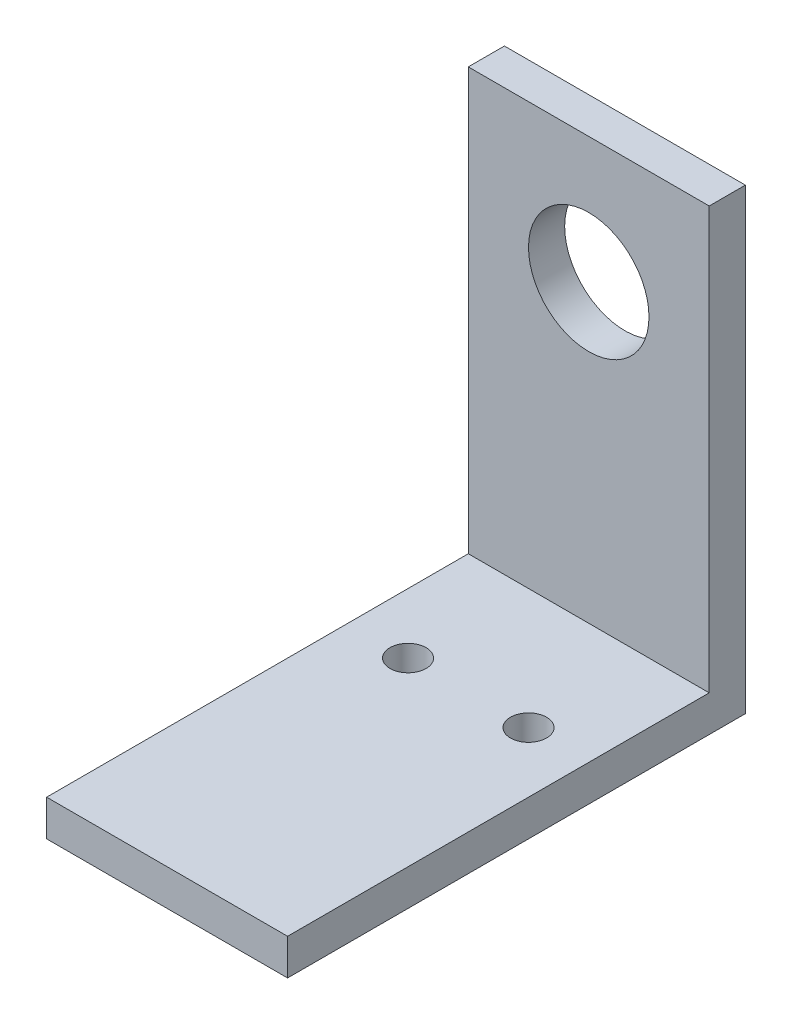
from build123d import *

# Parameters (mm, degrees)
SKETCH_1_W          = 20
SKETCH_1_H          = 38
EXTRUDE_1_DEPTH     = 3
SKETCH_2_W          = 20
SKETCH_2_H          = 3
EXTRUDE_2_DEPTH     = 35
SKETCH_4_R          = 1.5
CUT_EXTRUDE_2_DEPTH = 10
SKETCH_6_R          = 5
CUT_EXTRUDE_4_DEPTH = 10


with BuildPart() as part:
    # 草图1 → 凸台-拉伸1 (new body)
    with BuildSketch(Plane.XY):
        Rectangle(SKETCH_1_W, SKETCH_1_H)
    extrude(amount=EXTRUDE_1_DEPTH)

    # 草图2 → 凸台-拉伸2 (add)
    with BuildSketch(Plane.XY.offset(3)):
        with Locations((0, -17.5)):
            Rectangle(SKETCH_2_W, SKETCH_2_H)
    extrude(amount=EXTRUDE_2_DEPTH)

    # 草图4 → 切除-拉伸2 (cut)
    with BuildSketch(Plane(origin=(0, -16, 0), x_dir=(1, 0, 0), z_dir=(0, 1, 0))):
        with Locations((-5, -13)):
            Circle(SKETCH_4_R)
        with Locations((5, -13)):
            Circle(SKETCH_4_R)
    extrude(amount=-CUT_EXTRUDE_2_DEPTH, mode=Mode.SUBTRACT)

    # 草图6 → 切除-拉伸4 (cut)
    with BuildSketch(Plane(origin=(0, 0, 0), x_dir=(-1, 0, 0), z_dir=(0, 0, -1))):
        with Locations((0, 8.53)):
            Circle(SKETCH_6_R)
    extrude(amount=-CUT_EXTRUDE_4_DEPTH, mode=Mode.SUBTRACT)


solid = part.part
